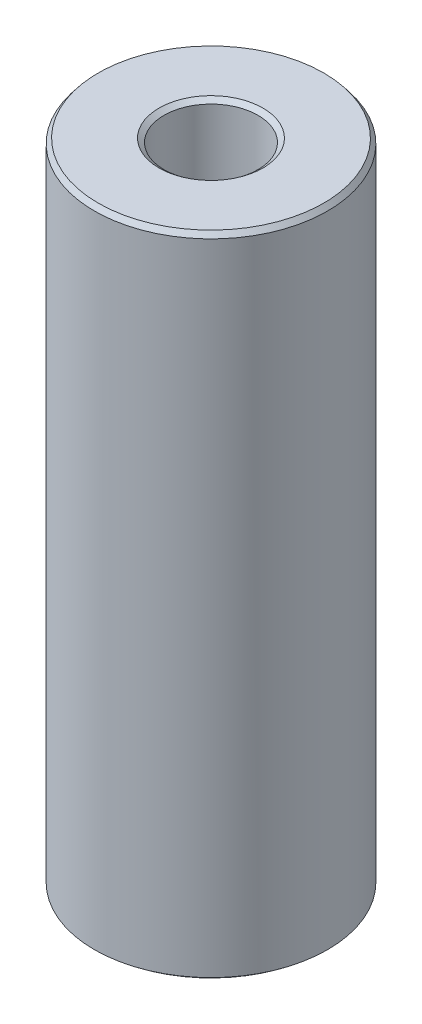
from build123d import *
from OCP.BRepFilletAPI import BRepFilletAPI_MakeChamfer

# Parameters (mm, degrees)
SKETCH1_R           = 55
BOSS_EXTRUDE1_DEPTH = 305.918689172
SKETCH2_R           = 22.194482262
CUT_EXTRUDE1_DEPTH  = 316.652093902
CHAMFER1_SIZE       = 2.31797989
CHAMFER1_SIZE2      = 1.80215995


with BuildPart() as part:
    # Sketch1 → Boss-Extrude1 (new body)
    with BuildSketch(Plane(origin=(0, 0, 0), x_dir=(1, 0, 0), z_dir=(0, 1, 0))):
        Circle(SKETCH1_R)
    extrude(amount=BOSS_EXTRUDE1_DEPTH)

    # Sketch2 → Cut-Extrude1 (cut, through all)
    with BuildSketch(Plane(origin=(0, 0, 0), x_dir=(1, 0, 0), z_dir=(0, 1, 0))):
        Circle(SKETCH2_R)
    extrude(amount=CUT_EXTRUDE1_DEPTH, mode=Mode.SUBTRACT)

    # Chamfer1: one chamfer whose edges measure the first distance from different faces: ONE call of the kernel's chamfer builder (chamfer() names one face for all edges)
    chamfer1_edges_1 = [part.edges().sort_by_distance(p)[0] for p in [
        (-22.194482262, 305.918689172, 0),
    ]]
    chamfer1_side_1 = [part.faces().sort_by_distance(p)[0] for p in [
        (-53.444365081, 305.918689172, 0),
    ]]
    chamfer1_edges_2 = [part.edges().sort_by_distance(p)[0] for p in [
        (-22.194482262, 0, 0),
    ]]
    chamfer1_side_2 = [part.faces().sort_by_distance(p)[0] for p in [
        (-22.194482262, 152.959344586, 0),
    ]]
    chamfer1_edges_3 = [part.edges().sort_by_distance(p)[0] for p in [
        (-55, 0, 0),
    ]]
    chamfer1_side_3 = [part.faces().sort_by_distance(p)[0] for p in [
        (-53.444365081, 0, 0),
    ]]
    chamfer1_edges_4 = [part.edges().sort_by_distance(p)[0] for p in [
        (-55, 305.918689172, 0),
    ]]
    chamfer1_side_4 = [part.faces().sort_by_distance(p)[0] for p in [
        (-55, 152.959344586, 0),
    ]]
    chamfer1 = BRepFilletAPI_MakeChamfer(part.part.solid().wrapped)
    for e in chamfer1_edges_1:
        chamfer1.Add(CHAMFER1_SIZE, CHAMFER1_SIZE2, e.wrapped, chamfer1_side_1[0].wrapped)  # the first distance lies on this face
    for e in chamfer1_edges_2:
        chamfer1.Add(CHAMFER1_SIZE, CHAMFER1_SIZE2, e.wrapped, chamfer1_side_2[0].wrapped)  # the first distance lies on this face
    for e in chamfer1_edges_3:
        chamfer1.Add(CHAMFER1_SIZE, CHAMFER1_SIZE2, e.wrapped, chamfer1_side_3[0].wrapped)  # the first distance lies on this face
    for e in chamfer1_edges_4:
        chamfer1.Add(CHAMFER1_SIZE, CHAMFER1_SIZE2, e.wrapped, chamfer1_side_4[0].wrapped)  # the first distance lies on this face
    add(Compound.cast(chamfer1.Shape()), mode=Mode.REPLACE)


solid = part.part
